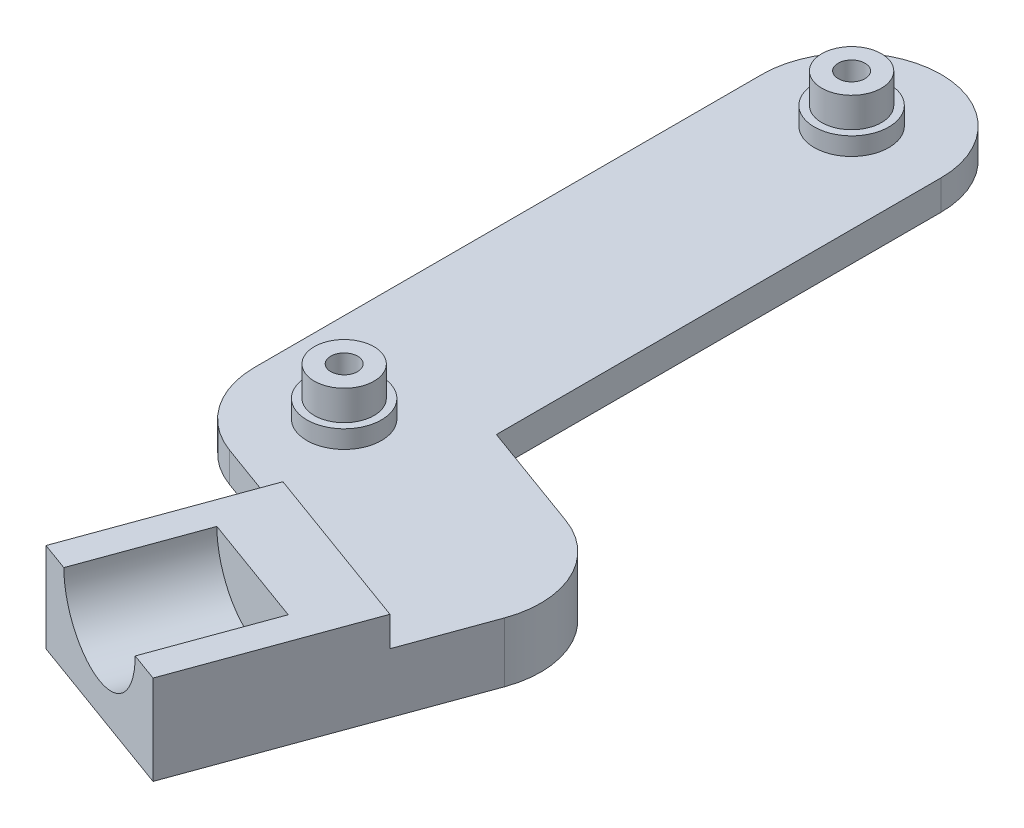
from build123d import *
from build123d.topology import SkipClean

# Parameters (mm, degrees)
EXTRUDE_1_DEPTH              = 5
SKETCH_2_R                   = 6.25
EXTRUDE_2_DEPTH              = 3
SKETCH_3_R                   = 5
EXTRUDE_3_DEPTH              = 5
HOLE_WIZARD_M4_1_D           = 4.5
HOLE_WIZARD_M4_1_CBORE_D     = 9
HOLE_WIZARD_M4_1_CBORE_DEPTH = 4
EXTRUDE_4_DEPTH              = 5
EXTRUDE_5_DEPTH              = 5
EXTRUDE_5_DEPTH_BACK         = 5
EXTRUDE_6_DEPTH              = 5
SKETCH_15_R                  = 10
CUT_EXTRUDE_2_DEPTH          = 20


with BuildPart() as part:
    # 스케치1 → 보스-돌출1 (new body)
    with BuildSketch(Plane(origin=(0, 0, 0), x_dir=(1, 0, 0), z_dir=(0, 1, 0))):
        with BuildLine():
            Line((-15, 0), (-15, 85))
            ThreePointArc((-15, 85), (0, 100), (15, 85))
            Line((15, 85), (15, 0))
            ThreePointArc((15, 0), (0, -15), (-15, 0))
        make_face()
    extrude(amount=EXTRUDE_1_DEPTH)

    # 스케치2 → 보스-돌출2 (add)
    with BuildSketch(Plane(origin=(0, 5, 0), x_dir=(1, 0, 0), z_dir=(0, 1, 0))):
        with Locations((0, 85)):
            Circle(SKETCH_2_R)
        Circle(SKETCH_2_R)
    extrude(amount=EXTRUDE_2_DEPTH)

    # 스케치3 → 보스-돌출3 (add)
    with BuildSketch(Plane(origin=(0, 8, 0), x_dir=(1, 0, 0), z_dir=(0, 1, 0))):
        with Locations((0, 85)):
            Circle(SKETCH_3_R)
        Circle(SKETCH_3_R)
    extrude(amount=EXTRUDE_3_DEPTH)

    # M4 남비 머리 나사용 카운터보어1 (through all)
    with Locations(Plane(origin=(0, 0, 0), x_dir=(-1, 0, 0), z_dir=(0, -1, 0))):
        with Locations((0, 85), (0, 0)):
            CounterBoreHole(HOLE_WIZARD_M4_1_D / 2, HOLE_WIZARD_M4_1_CBORE_D / 2, HOLE_WIZARD_M4_1_CBORE_DEPTH)

    # 스케치8 → 보스-돌출4 (add)
    with BuildSketch(Plane.XZ):
        with BuildLine():
            Line((-5.13030215, 14.095389312), (23.060476474, 24.355993612))
            ThreePointArc((23.060476474, 24.355993612), (42.286167935, 15.39090645), (33.321080773, -3.834785012))
            Line((33.321080773, -3.834785012), (15, -10.503113073))
            Line((15, -10.503113073), (15, 0))
            ThreePointArc((15, 0), (8.603646545, 12.287280664), (-5.13030215, 14.095389312))
        make_face()
    extrude(amount=-EXTRUDE_4_DEPTH)

    # 스케치9 → 보스-돌출5 (add, two sides: drawn at the far end of the back side and taken through both)
    with SkipClean():  # the faces are left unmerged after this step: merging them gives an invalid solid
        with BuildSketch(Plane.XZ.offset(-EXTRUDE_5_DEPTH_BACK)):
            with BuildLine():
                Line((14.095389312, 5.13030215), (3.834785012, 33.321080773))
                Line((3.834785012, 33.321080773), (-1.624768502, 48.321080773))
                Line((-1.624768502, 48.321080773), (26.566010122, 58.581685073))
                Line((26.566010122, 58.581685073), (32.025563636, 43.581685073))
                Line((32.025563636, 43.581685073), (42.286167935, 15.39090645))
                ThreePointArc((42.286167935, 15.39090645), (33.321080773, -3.834785012), (14.095389312, 5.13030215))
            make_face()
        extrude(amount=EXTRUDE_5_DEPTH + EXTRUDE_5_DEPTH_BACK)

    # 스케치13 → 보스-돌출6 (add)
    with SkipClean():  # the faces are left unmerged after this step: merging them gives an invalid solid
        with BuildSketch(Plane(origin=(0, 5, 0), x_dir=(1, 0, 0), z_dir=(0, 1, 0))):
            Polygon((37.155865785, -29.486295761), (26.566010122, -58.581685073), (-1.624768502, -48.321080773), (8.965087162, -19.225691462), align=None)
        extrude(amount=EXTRUDE_6_DEPTH)

    # 스케치15 → 컷-돌출2 (cut)
    with SkipClean():  # the faces are left unmerged after this step: merging them gives an invalid solid
        with BuildSketch(Plane(origin=(-15.720157814, 0, 43.190778624), x_dir=(0.9396926207859084, 0, 0.3420201433256689), z_dir=(-0.3420201433256689, 0, 0.9396926207859084))):
            with Locations((30, 10)):
                Circle(SKETCH_15_R)
        extrude(amount=-CUT_EXTRUDE_2_DEPTH, mode=Mode.SUBTRACT)


solid = part.part
